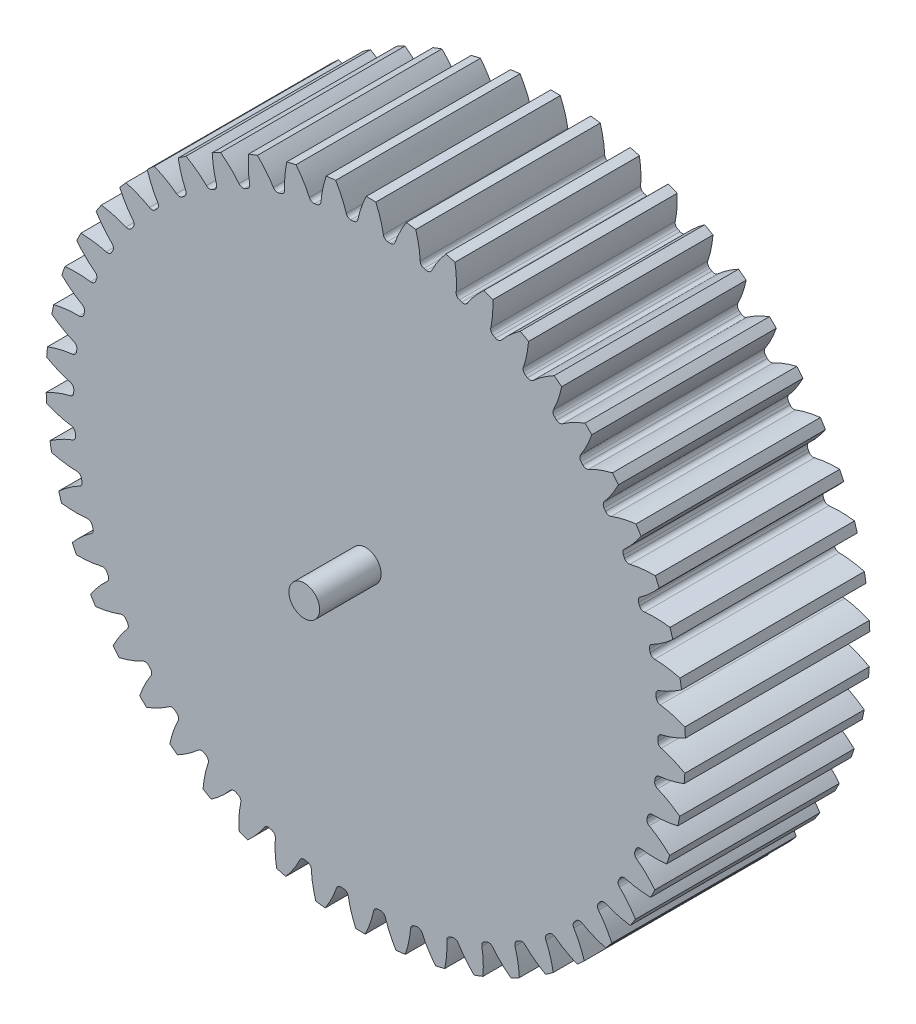
from build123d import *

# Parameters (mm, degrees)
SKETCH_3_R               = 47.5
EXTRUDE_2_DEPTH          = 30
EXTRUDE_3_DEPTH          = 30
PATTERN_CIRCULAR_1_COUNT = 50
SKETCH_5_R               = 2.5
EXTRUDE_4_DEPTH          = 5
SKETCH_7_R               = 2.5
EXTRUDE_5_DEPTH          = 5
CUT_EXTRUDE_2_DEPTH      = 6


with BuildPart() as part:
    # 草图3 → 凸台-拉伸2 (new body)
    with BuildSketch(Plane.XY):
        Circle(SKETCH_3_R)
    extrude(amount=EXTRUDE_2_DEPTH)

    # 草图3<6> → 凸台-拉伸3 (add)
    with BuildSketch(Plane.XY):
        with BuildLine():
            ThreePointArc((47.240134538, 4.961823131), (47.434989146, 2.484311718), (47.5, 0))
            ThreePointArc((47.5, 0), (47.499143619, -0.285228757), (47.496574508, -0.57044723))
            ThreePointArc((47.496574508, -0.57044723), (47.666612465, -0.100398578), (48.091832937, 0.162367843))
            add(Edge.make_bspline(
                [(48.091832937, 0.162367843), (48.176704954, 0.181206638), (48.367561244, 0.225841672), (48.662931975, 0.302256764), (49.060373303, 0.418864361), (49.475029043, 0.554468064), (49.885749314, 0.701702497), (50.29244253, 0.859470966), (50.78124445, 1.062937418), (51.252921139, 1.275629596), (51.620768532, 1.453433419), (51.88788767, 1.588589206), (51.974353385, 1.63296976)],
                knots=[0.07029499, 0.07029499, 0.07029499, 0.07029499, 0.07029499, 0.092110525, 0.119476176, 0.146842496, 0.174208854, 0.201574956, 0.228941013, 0.256307345, 0.307035032, 0.331424171, 0.331424171, 0.331424171, 0.331424171, 0.331424171], degree=4))
            ThreePointArc((51.974353385, 1.63296976), (51.944225098, 2.407795464), (51.902546471, 3.182085769))
            add(Edge.make_bspline(
                [(47.900631848, 4.287216704), (47.986882671, 4.276310047), (48.181049661, 4.249522181), (48.48222284, 4.200758974), (48.888747068, 4.121417977), (49.314169185, 4.024754804), (49.736748647, 3.91614671), (50.156292807, 3.796677217), (50.66182102, 3.639301424), (51.151150891, 3.471155243), (51.533869235, 3.328142751), (51.812345963, 3.21827723), (51.902546471, 3.182085769)],
                knots=[0.07029499, 0.07029499, 0.07029499, 0.07029499, 0.07029499, 0.092110525, 0.119476176, 0.146842496, 0.174208854, 0.201574956, 0.228941013, 0.256307345, 0.307035032, 0.331424171, 0.331424171, 0.331424171, 0.331424171, 0.331424171], degree=4))
            ThreePointArc((47.900631848, 4.287216704), (47.452926709, 4.509519987), (47.240134538, 4.961823131))
        make_face()
    extrude_3 = extrude(amount=EXTRUDE_3_DEPTH)

    # 阵列(圆周)1: 凸台-拉伸3 ×50 about axis
    pattern_circular_1_axis = Axis((0, 0, 30), (0, 0, -1))
    for i in range(1, PATTERN_CIRCULAR_1_COUNT):
        add(extrude_3.rotate(pattern_circular_1_axis, i * 360 / PATTERN_CIRCULAR_1_COUNT))

    # 草图5 → 凸台-拉伸4 (add)
    with BuildSketch(Plane.XY.offset(30)):
        Circle(SKETCH_5_R)
    extrude(amount=EXTRUDE_4_DEPTH)

    # 草图7 → 凸台-拉伸5 (add)
    with BuildSketch(Plane.XY.offset(35)):
        Circle(SKETCH_7_R)
    extrude(amount=EXTRUDE_5_DEPTH)

    # 草图8 → 切除-拉伸2 (cut)
    with BuildSketch(Plane(origin=(0, 0, 0), x_dir=(-1, 0, 0), z_dir=(0, 0, -1))):
        with BuildLine():
            Line((-2, 1.5), (2, 1.5))
            ThreePointArc((2, 1.5), (2.5, 0), (2, -1.5))
            Line((2, -1.5), (-2, -1.5))
            ThreePointArc((-2, -1.5), (-2.5, 0), (-2, 1.5))
        make_face()
    extrude(amount=-CUT_EXTRUDE_2_DEPTH, mode=Mode.SUBTRACT)


solid = part.part
